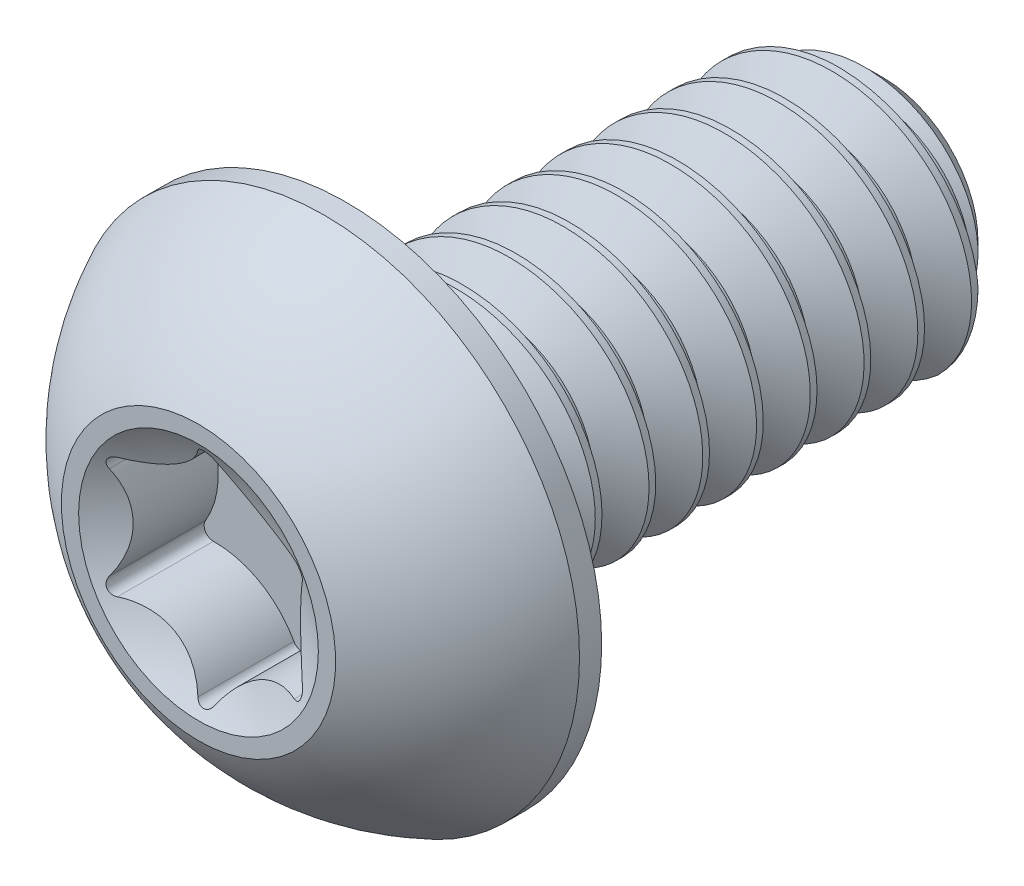
from build123d import *
from build123d.topology import SkipClean

# Parameters (mm, degrees)
CUT_EXTRUDE1_DEPTH = 0.77
CIRPATTERN1_COUNT  = 6
CUT_SWEEP1_PITCH   = 0.4


# Read off the part's stored shape, not the designer's step: Split1
with BuildPart() as part:
    # Sketch2 → Revolve1 (revolve)
    with BuildSketch(Plane(origin=(0, 0, 0), x_dir=(0, 0, -1), z_dir=(1, 0, 0))):
        Polygon((1.1, 1), (4.8, 1), (5.1, 0.7), (5.1, 0), (1.1, 0), align=None)
    revolve(axis=Axis((0, 0, -5.1), (0, 0, 1)))


with BuildPart() as body_2:
    # Sketch3 → Revolve2 (revolve)
    with BuildSketch(Plane(origin=(0, 0, 0), x_dir=(0, 0, -1), z_dir=(1, 0, 0)), mode=Mode.PRIVATE) as revolve2_sk:
        with BuildLine():
            Line((1.1, 0), (1.1, 1.9))
            Line((1.1, 1.9), (0.935, 1.9))
            ThreePointArc((0.935, 1.9), (0.398804, 1.533165), (0, 1.0203))
            Line((0, 1.0203), (0, 0))
            Line((0, 0), (1.1, 0))
        make_face()
    revolve(revolve2_sk.sketch.rotate(Axis((0, 0, 0), (0, 0, -1)), 90), axis=Axis((0, 0, 0), (0, 0, -1)))

    # Combine1: union part
    add(part.part)

    # Sketch4 → Cut-Extrude1 (cut)
    with BuildSketch(Plane.XY):
        with BuildLine():
            Line((0, 0), (-0.719061, 0.41515))
            ThreePointArc((-0.719061, 0.41515), (-0.728207, 0.38044), (-0.718486, 0.345886))
            ThreePointArc((-0.718486, 0.345886), (-0.622725, 0), (-0.718486, -0.345886))
            ThreePointArc((-0.718486, -0.345886), (-0.728207, -0.38044), (-0.719061, -0.41515))
            Line((-0.719061, -0.41515), (0, 0))
        make_face()
    cut_extrude1 = extrude(amount=-CUT_EXTRUDE1_DEPTH, mode=Mode.SUBTRACT)

    # CirPattern1: Cut-Extrude1 ×6 about axis
    cirpattern1_axis = Axis((0, 0, 0), (0, 0, 1))
    for i in range(1, CIRPATTERN1_COUNT):
        add(cut_extrude1.rotate(cirpattern1_axis, i * 360 / CIRPATTERN1_COUNT), mode=Mode.SUBTRACT)

    # Sketch5 → Cut-Revolve1 (revolve, cut)
    with SkipClean():  # the faces are left unmerged after this step: merging them gives an invalid solid
        with BuildSketch(Plane(origin=(0, 0, 0), x_dir=(0, 0, -1), z_dir=(1, 0, 0))):
            with BuildLine():
                Line((-1.421546, 1.678212), (-1.421546, -1.678212))
                ThreePointArc((-1.421546, -1.678212), (0.256667, 0), (-1.421546, 1.678212))
            make_face()
        revolve(axis=Axis((0, 1.678212, 1.421546), (0, -1, 0)), mode=Mode.SUBTRACT)


with BuildPart() as body_2_2:
    # Split1: the piece on the far side of the plane
    add(body_2.part)
    split(bisect_by=Plane.XY.offset(-1.1), keep=Keep.BOTTOM)

    # Cut-Sweep1: the profile of Sketch7 screwed along a right-hand helix of 11 turns, 6 arcs to a turn; built about Z, then put on its axis
    cut_sweep1_z = Axis((0, 0, 0), (0, 0, 1))
    cut_sweep1_corners = [(1.021651, 0, 0.0125), (1.021651, 0, -0.3625), (0.740192, 0, -0.2), (0.740192, 0, -0.15)]
    with BuildLine(mode=Mode.PRIVATE) as cut_sweep1_profile:
        Line(cut_sweep1_corners[0], cut_sweep1_corners[1])
        Line(cut_sweep1_corners[1], cut_sweep1_corners[2])
        Line(cut_sweep1_corners[2], cut_sweep1_corners[3])
        Line(cut_sweep1_corners[3], cut_sweep1_corners[0])
    cut_sweep1_cap = Face(cut_sweep1_profile.wire())
    cut_sweep1_turn_angles = [0, 30, 60, 90, 120, 150, 180, 210, 240, 270, 300, 330, 360]
    cut_sweep1_turn_weights = [1, 0.8660254037844387, 1, 0.8660254037844387, 1, 0.8660254037844387, 1, 0.8660254037844387, 1, 0.8660254037844387, 1, 0.8660254037844387, 1]
    cut_sweep1_turn_rails = [Edge.make_bspline([Vector(p[0], p[1], 0).rotate(cut_sweep1_z, cut_sweep1_turn_angles[k]) / cut_sweep1_turn_weights[k] + Vector(0, 0, p[2] + CUT_SWEEP1_PITCH * cut_sweep1_turn_angles[k] / 360) for k in range(13)], [0, 0, 0, 1, 1, 2, 2, 3, 3, 4, 4, 5, 5, 6, 6, 6], 2, cut_sweep1_turn_weights) for p in cut_sweep1_corners]
    cut_sweep1_turn_sides = [Face.make_surface_from_curves(cut_sweep1_turn_rails[p[0]], cut_sweep1_turn_rails[p[1]]) for p in [(0, 1), (1, 2), (2, 3), (3, 0)]]
    cut_sweep1 = Plane(origin=(0, 0, -5.1), x_dir=(0, 1, 0), z_dir=(0, 0, 1)) * Solid(Shell([*[p.moved(Location((0, 0, CUT_SWEEP1_PITCH * i))) for i in range(11) for p in cut_sweep1_turn_sides], cut_sweep1_cap, cut_sweep1_cap.rotate(cut_sweep1_z, 3960).moved(Location((0, 0, CUT_SWEEP1_PITCH * 3960 / 360)))]))
    add(cut_sweep1, mode=Mode.SUBTRACT)


with BuildPart() as body_2_1:
    add(body_2.part)

    # Split1
    split(bisect_by=Plane.XY.offset(-1.1), keep=Keep.TOP)

    with SkipClean():  # the faces are left unmerged after this step: merging them gives an invalid solid
        add(body_2_2.part)  # Boss-Extrude1 merges body 2 2
        # Boss-Extrude1 cone 1 section (through the dimple's axis) → Boss-Extrude1 (revolve)
        with BuildSketch(Plane(origin=(0, 0, -1.1), x_dir=(0, -1, 0), z_dir=(1, 0, 0))):
            Polygon((0, 0), (1.0508, 0), (0, 2.887049), align=None)
        revolve(axis=Axis((0, 0, -1.1), (0, 0, -1)))


solid = body_2_1.part
